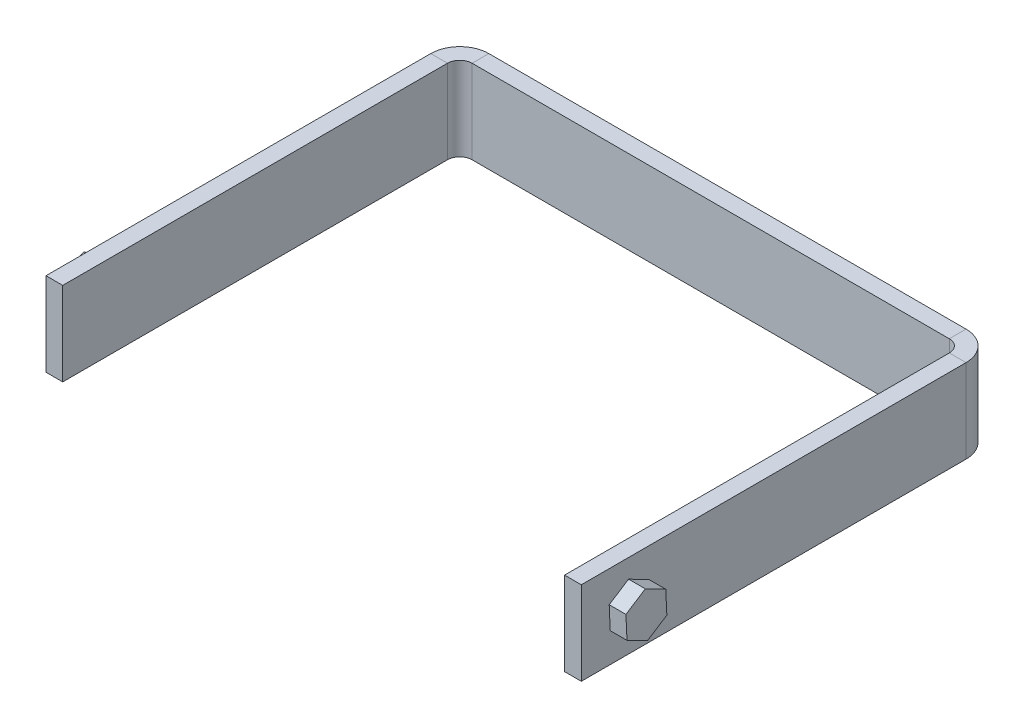
from build123d import *

# Parameters (mm, degrees)
SKETCH1_W                      = 32
SKETCH1_H                      = 5
BASE_FLANGE1_DEPTH             = 1
EDGE_FLANGE1_STRIP_W           = 5.4732
EDGE_FLANGE1_STRIP_H           = 1
EDGE_FLANGE1_STRIP_CUT_DEPTH   = 5
EDGE_FLANGE1_STRIP_2_W         = 5.4732
EDGE_FLANGE1_STRIP_2_H         = 1
EDGE_FLANGE1_STRIP_CUT_2_DEPTH = 5
EDGE_FLANGE1_DEPTH             = 5
EDGE_FLANGE1_BEND_DEPTH        = 5
BOSS_EXTRUDE1_DEPTH            = 1
BOSS_EXTRUDE2_DEPTH            = 1


# Sheet-metal steps are written as plain solids
with BuildPart() as part:
    # Sketch1 → Base-Flange1 (new body)
    with BuildSketch(Plane.XY):
        Rectangle(SKETCH1_W, SKETCH1_H)
    extrude(amount=-BASE_FLANGE1_DEPTH)

    # Edge-Flange1 strip (across the edge) → Edge-Flange1 strip cut (cut)
    with BuildSketch(Plane(origin=(-16, 2.5, 0), x_dir=(1, 0, 0), z_dir=(0, -1, 0))):
        with Locations((-1, -0.5)):
            Rectangle(EDGE_FLANGE1_STRIP_W, EDGE_FLANGE1_STRIP_H)
    extrude(amount=EDGE_FLANGE1_STRIP_CUT_DEPTH, mode=Mode.SUBTRACT)

    # Edge-Flange1 strip 2 (across the edge) → Edge-Flange1 strip cut 2 (cut)
    with BuildSketch(Plane(origin=(16, -2.5, 0), x_dir=(-1, 0, 0), z_dir=(0, 1, 0))):
        with Locations((-1, -0.5)):
            Rectangle(EDGE_FLANGE1_STRIP_2_W, EDGE_FLANGE1_STRIP_2_H)
    extrude(amount=EDGE_FLANGE1_STRIP_CUT_2_DEPTH, mode=Mode.SUBTRACT)

    # Edge-Flange1 section (across the edge) → Edge-Flange1 (add)
    with BuildSketch(Plane(origin=(-16, 2.5, 0), x_dir=(1, 0, 0), z_dir=(0, -1, 0))):
        with BuildLine():
            Line((0, 0.7366), (0, 23.7366))
            Line((0, 23.7366), (1, 23.7366))
            Line((1, 23.7366), (1, 0.7366))
            ThreePointArc((1, 0.7366), (1.215745145, 0.215745145), (1.7366, 0))
            Line((1.7366, 0), (1.7366, -1))
            ThreePointArc((1.7366, -1), (0.508638364, -0.491361636), (0, 0.7366))
        make_face()
    extrude(amount=EDGE_FLANGE1_DEPTH)

    # Edge-Flange1 section 2 (across the edge) → Edge-Flange1 bend (add)
    with BuildSketch(Plane(origin=(16, -2.5, 0), x_dir=(-1, 0, 0), z_dir=(0, 1, 0))):
        with BuildLine():
            Line((0, 0.7366), (0, 23.7366))
            Line((0, 23.7366), (1, 23.7366))
            Line((1, 23.7366), (1, 0.7366))
            ThreePointArc((1, 0.7366), (1.215745145, 0.215745145), (1.7366, 0))
            Line((1.7366, 0), (1.7366, -1))
            ThreePointArc((1.7366, -1), (0.508638364, -0.491361636), (0, 0.7366))
        make_face()
    extrude(amount=EDGE_FLANGE1_BEND_DEPTH)

    # Sketch12 → Boss-Extrude1 (add)
    with BuildSketch(Plane(origin=(16, 0, 0), x_dir=(0, 0, -1), z_dir=(1, 0, 0))):
        Polygon((-19.622935429, -0.632906062), (-19.686371165, 0.74277998), (-20.909468094, 1.375686043), (-22.069129286, 0.632906062), (-22.00569355, -0.74277998), (-20.782596622, -1.375686043), align=None)
    extrude(amount=BOSS_EXTRUDE1_DEPTH)

    # Sketch13 → Boss-Extrude2 (add)
    with BuildSketch(Plane.ZY.offset(16)):
        Polygon((22.141401041, -0.649858365), (21.962250454, 0.960156284), (20.478361573, 1.61001465), (19.17362328, 0.649858365), (19.352773867, -0.960156284), (20.836662748, -1.61001465), align=None)
    extrude(amount=BOSS_EXTRUDE2_DEPTH)


solid = part.part
